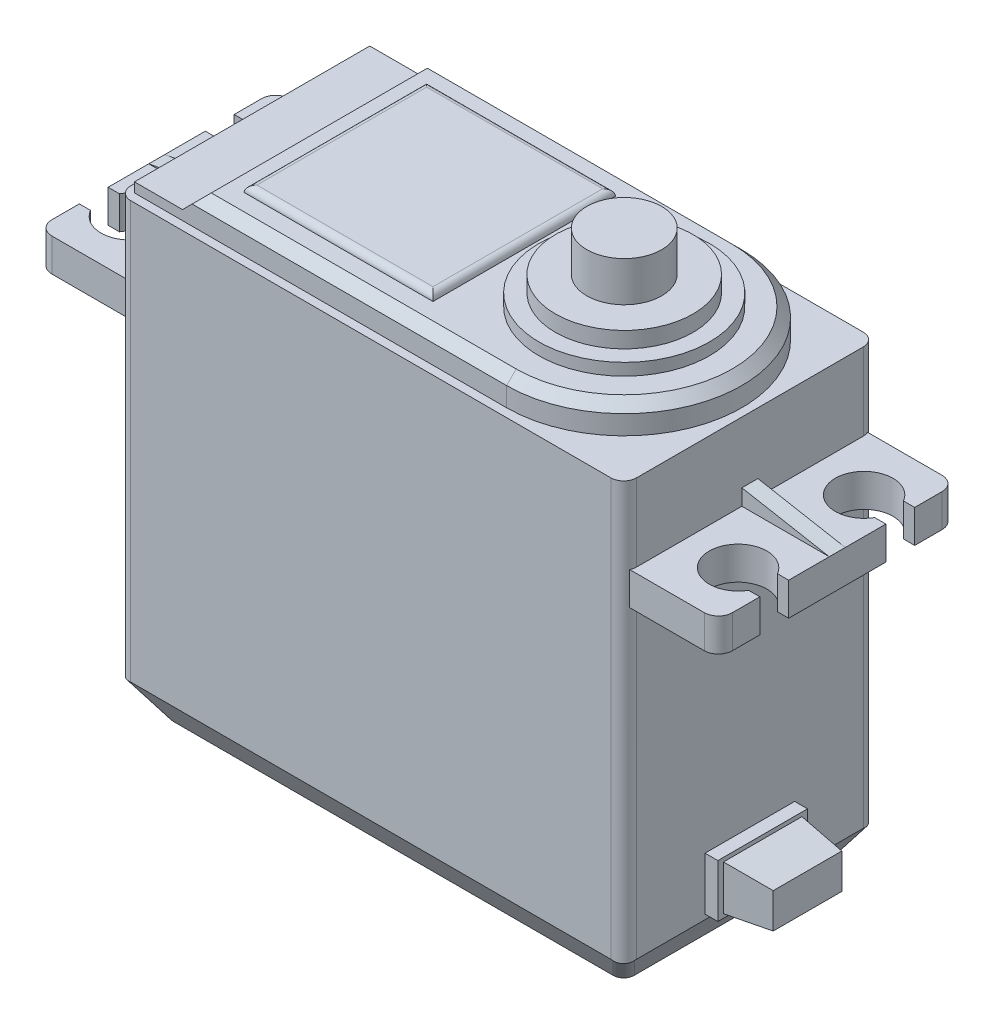
from build123d import *
from OCP.BRepFilletAPI import BRepFilletAPI_MakeChamfer

# Parameters (mm, degrees)
SKETCH1_W            = 40.132
SKETCH1_H            = 20.0279
BOSS_EXTRUDE1_DEPTH  = 35.8775
CHAMFER1_SIZE        = 1.778
CHAMFER1_SIZE2       = 2.794
SKETCH2_W            = 7.112
SKETCH2_H            = 4.191
BOSS_EXTRUDE2_DEPTH  = 1.016
SKETCH3_W            = 6.223
SKETCH3_H            = 3.556
BOSS_EXTRUDE3_DEPTH  = 3.556
CHAMFER2_SIZE        = 3.556
CHAMFER2_SIZE_2      = 0.389445338
SKETCH4_W            = 18.8722
SKETCH4_H            = 2.6162
BOSS_EXTRUDE4_DEPTH  = 6.9342
BOSS_EXTRUDE5_DEPTH  = 0.635
CUT_EXTRUDE1_REACH   = 61.169
FILLET2_R            = 1.1176
FILLET2_OF_MIRROR3_R = 1.1176
BOSS_EXTRUDE6_DEPTH  = 2.286
CHAMFER3_SIZE        = 0.762
CUT_EXTRUDE2_DEPTH   = 64.608509117
FILLET3_R            = 1.016
SKETCH12_R           = 6.7691
BOSS_EXTRUDE7_DEPTH  = 0.9525
SKETCH13_R           = 5.461
BOSS_EXTRUDE8_DEPTH  = 1.27
SKETCH15_R           = 2.9718
BOSS_EXTRUDE9_DEPTH  = 3.175
SKETCH16_W           = 14.986
SKETCH16_H           = 14.478
BOSS_EXTRUDE10_DEPTH = 0.508
FILLET4_R            = 0.508


# Some blends are built 0.0001 mm under size
with BuildPart() as part:
    # Sketch1 → Boss-Extrude1 (new body)
    with BuildSketch(Plane(origin=(0, 0, 0), x_dir=(1, 0, 0), z_dir=(0, 1, 0))):
        with Locations((20.066, 10.01395)):
            Rectangle(SKETCH1_W, SKETCH1_H)
    extrude(amount=BOSS_EXTRUDE1_DEPTH)

    # Chamfer1
    chamfer1_edges = [part.edges().sort_by_distance(p)[0] for p in [
        (20.066, 0, -20.0279),
        (40.132, 0, -10.01395),
        (20.066, 0, 0),
        (0, 0, -10.01395),
    ]]
    chamfer1_side = [part.faces().sort_by_distance(p)[0] for p in [
        (20.066, 0, -10.01395),
    ]]
    chamfer(chamfer1_edges, length=CHAMFER1_SIZE, length2=CHAMFER1_SIZE2, reference=chamfer1_side[0])

    # Sketch2 → Boss-Extrude2 (add)
    with BuildSketch(Plane(origin=(40.132, 0, 0), x_dir=(0, 0, -1), z_dir=(1, 0, 0))):
        with Locations((10.01395, 5.2705)):
            Rectangle(SKETCH2_W, SKETCH2_H)
    extrude(amount=BOSS_EXTRUDE2_DEPTH)

    # Sketch3 → Boss-Extrude3 (add)
    with BuildSketch(Plane(origin=(41.148, 0, 0), x_dir=(0, 0, -1), z_dir=(1, 0, 0))):
        with Locations((10.01395, 5.2705)):
            Rectangle(SKETCH3_W, SKETCH3_H)
    extrude(amount=BOSS_EXTRUDE3_DEPTH)

    # Chamfer2
    chamfer2_edges_1 = [part.edges().sort_by_distance(p)[0] for p in [
        (44.704, 3.4925, -10.01395),
    ]]
    chamfer2_side_1 = [part.faces().sort_by_distance(p)[0] for p in [
        (44.696211093, 3.4925, -10.01395),
    ]]
    chamfer2_edges_2 = [part.edges().sort_by_distance(p)[0] for p in [
        (44.704, 5.2705, -6.90245),
    ]]
    chamfer2_side_2 = [part.faces().sort_by_distance(p)[0] for p in [
        (44.696211093, 5.2705, -6.90245),
    ]]
    chamfer2_edges_3 = [part.edges().sort_by_distance(p)[0] for p in [
        (44.704, 7.0485, -10.01395),
    ]]
    chamfer2_side_3 = [part.faces().sort_by_distance(p)[0] for p in [
        (44.696211093, 7.0485, -10.01395),
    ]]
    chamfer2_edges_4 = [part.edges().sort_by_distance(p)[0] for p in [
        (44.704, 5.2705, -13.12545),
    ]]
    chamfer2_side_4 = [part.faces().sort_by_distance(p)[0] for p in [
        (44.696211093, 5.2705, -13.12545),
    ]]
    chamfer2 = BRepFilletAPI_MakeChamfer(part.part.solid().wrapped)
    for e in chamfer2_edges_1:
        chamfer2.Add(CHAMFER2_SIZE - 0.0001, CHAMFER2_SIZE_2 - 0.0001, e.wrapped, chamfer2_side_1[0].wrapped)
    for e in chamfer2_edges_2:
        chamfer2.Add(CHAMFER2_SIZE - 0.0001, CHAMFER2_SIZE_2 - 0.0001, e.wrapped, chamfer2_side_2[0].wrapped)
    for e in chamfer2_edges_3:
        chamfer2.Add(CHAMFER2_SIZE - 0.0001, CHAMFER2_SIZE_2 - 0.0001, e.wrapped, chamfer2_side_3[0].wrapped)
    for e in chamfer2_edges_4:
        chamfer2.Add(CHAMFER2_SIZE - 0.0001, CHAMFER2_SIZE_2 - 0.0001, e.wrapped, chamfer2_side_4[0].wrapped)
    add(Compound.cast(chamfer2.Shape()), mode=Mode.REPLACE)  # a hair under: the kernel refuses the full size

    # Sketch4 → Boss-Extrude4 (add)
    with BuildSketch(Plane(origin=(40.132, 0, 0), x_dir=(0, 0, -1), z_dir=(1, 0, 0))):
        with Locations((10.01395, 28.4353)):
            Rectangle(SKETCH4_W, SKETCH4_H)
    boss_extrude4 = extrude(amount=BOSS_EXTRUDE4_DEPTH)

    # Sketch8 → Boss-Extrude5 (add, symmetric)
    with BuildSketch(Plane.XY.offset(-10.01395)):
        Polygon((47.0662, 29.7434), (40.132, 29.7434), (40.132, 31.0134), align=None)
    boss_extrude5 = extrude(amount=BOSS_EXTRUDE5_DEPTH, both=True)

    # Sketch9 → Cut-Extrude1 (cut, up to next)
    with BuildSketch(Plane(origin=(0, 29.7434, 0), x_dir=(1, 0, 0), z_dir=(0, 1, 0)), mode=Mode.PRIVATE) as cut_extrude1_sk1:
        with BuildLine():
            Line((47.0662, 3.87095), (46.175734073, 3.87095))
            ThreePointArc((46.175734073, 3.87095), (41.91, 5.01395), (46.175734073, 6.15695))
            Line((46.175734073, 6.15695), (47.0662, 6.15695))
            Line((47.0662, 6.15695), (47.0662, 3.87095))
        make_face()
    cut_extrude1_tool1 = extrude(cut_extrude1_sk1.sketch, amount=-CUT_EXTRUDE1_REACH, mode=Mode.PRIVATE) & part.part
    # Sketch9 → Cut-Extrude1 (cut, up to next)
    with BuildSketch(Plane(origin=(0, 29.7434, 0), x_dir=(1, 0, 0), z_dir=(0, 1, 0)), mode=Mode.PRIVATE) as cut_extrude1_sk2:
        with BuildLine():
            Line((46.175734073, 13.87095), (47.0662, 13.87095))
            Line((47.0662, 13.87095), (47.0662, 16.15695))
            Line((47.0662, 16.15695), (46.175734073, 16.15695))
            ThreePointArc((46.175734073, 16.15695), (41.91, 15.01395), (46.175734073, 13.87095))
        make_face()
    cut_extrude1_tool2 = extrude(cut_extrude1_sk2.sketch, amount=-CUT_EXTRUDE1_REACH, mode=Mode.PRIVATE) & part.part
    cut_extrude1_1 = cut_extrude1_tool1.solids().sort_by_distance((44.41518, 29.7434, -5.01395))[0]
    add(cut_extrude1_1, mode=Mode.SUBTRACT)
    cut_extrude1_2 = cut_extrude1_tool2.solids().sort_by_distance((44.41518, 29.7434, -15.01395))[0]
    add(cut_extrude1_2, mode=Mode.SUBTRACT)
    cut_extrude1 = cut_extrude1_1 + cut_extrude1_2  # Cut-Extrude1 as one shape, for the pattern or mirror that repeats it

    # Fillet2
    fillet2_edges = [part.edges().sort_by_distance(p)[0] for p in [
        (47.0662, 28.4353, -19.45005),
        (47.0662, 28.4353, -0.57785),
    ]]
    fillet(fillet2_edges, radius=FILLET2_R)

    # Mirror3: Boss-Extrude4, Boss-Extrude5, Cut-Extrude1 across plane
    add(boss_extrude4.mirror(Plane(origin=(20.066, 0, 0), x_dir=(0, 0, 1), z_dir=(1, 0, 0))))
    add(boss_extrude5.mirror(Plane(origin=(20.066, 0, 0), x_dir=(0, 0, 1), z_dir=(1, 0, 0))))
    add(cut_extrude1.mirror(Plane(origin=(20.066, 0, 0), x_dir=(0, 0, 1), z_dir=(1, 0, 0))), mode=Mode.SUBTRACT)

    # Fillet2 of Mirror3
    fillet2_of_mirror3_edges = [part.edges().sort_by_distance(p)[0] for p in [
        (-6.9342, 28.4353, -19.45005),
        (-6.9342, 28.4353, -0.57785),
    ]]
    fillet(fillet2_of_mirror3_edges, radius=FILLET2_OF_MIRROR3_R)

    # Sketch10 → Boss-Extrude6 (add)
    with BuildSketch(Plane(origin=(0, 35.8775, 0), x_dir=(1, 0, 0), z_dir=(0, 1, 0))):
        with BuildLine():
            Line((30.1625, 0.67945), (0.635, 0.67945))
            Line((0.635, 0.67945), (0.635, 19.34845))
            Line((0.635, 19.34845), (30.1625, 19.34845))
            ThreePointArc((30.1625, 19.34845), (39.497, 10.01395), (30.1625, 0.67945))
        make_face()
    extrude(amount=BOSS_EXTRUDE6_DEPTH)

    # Chamfer3
    chamfer3_edges = [part.edges().sort_by_distance(p)[0] for p in [
        (39.497, 38.1635, -10.01395),
        (15.39875, 38.1635, -19.34845),
        (0.635, 38.1635, -10.01395),
        (15.39875, 38.1635, -0.67945),
    ]]
    chamfer(chamfer3_edges, length=CHAMFER3_SIZE)

    # Sketch11 → Cut-Extrude2 (cut, through all)
    with BuildSketch(Plane(origin=(0, 0, -19.34845), x_dir=(-1, 0, 0), z_dir=(0, 0, -1))):
        Polygon((-0.635, 36.6395), (-4.445, 36.6395), (-5.969, 38.1635), (-0.635, 38.1635), align=None)
    extrude(amount=-CUT_EXTRUDE2_DEPTH, mode=Mode.SUBTRACT)

    # Fillet3
    # the kernel refuses this fillet: 1.016 mm, written as the material it takes off along each edge
    with BuildSketch(Plane(origin=(0, 0.254, 0), x_dir=(1, 0, 0), z_dir=(0, 1, 0))) as fillet3_piece_1_section:
        with BuildLine():
            CenterArc((FILLET3_R, FILLET3_R), FILLET3_R, 180, 90)
            Line((0, FILLET3_R), (0, 0))
            Line((0, 0), (FILLET3_R, 0))
        make_face()
    fillet3_piece_1 = extrude(amount=38.1635, mode=Mode.PRIVATE)
    fillet3_piece_1 = split(fillet3_piece_1, bisect_by=Plane(origin=(0.25078898, 27.1272, -0.181992071), z_dir=(0, -1, 0)), keep=Keep.TOP, mode=Mode.PRIVATE)
    fillet3_piece_1 = split(fillet3_piece_1, bisect_by=Plane(origin=(0.25078898, 13.6906, -0.57785), z_dir=(0, 0, 1)), keep=Keep.TOP, mode=Mode.PRIVATE)
    add(fillet3_piece_1, mode=Mode.SUBTRACT)
    with BuildSketch(Plane(origin=(0, 0.254, 0), x_dir=(1, 0, 0), z_dir=(0, 1, 0))) as fillet3_piece_2_section:
        with BuildLine():
            CenterArc((FILLET3_R, FILLET3_R), FILLET3_R, 180, 90)
            Line((0, FILLET3_R), (0, 0))
            Line((0, 0), (FILLET3_R, 0))
        make_face()
    fillet3_piece_2 = extrude(amount=38.1635, mode=Mode.PRIVATE)
    fillet3_piece_2 = split(fillet3_piece_2, bisect_by=Plane(origin=(0.014243529, 27.1272, -0.728902871), z_dir=(0, -1, 0)), keep=Keep.TOP, mode=Mode.PRIVATE)
    fillet3_piece_2 = split(fillet3_piece_2, bisect_by=Plane(origin=(0.014243529, 13.6906, -0.57785), z_dir=(0, 0, -1)), keep=Keep.TOP, mode=Mode.PRIVATE)
    add(fillet3_piece_2, mode=Mode.SUBTRACT)
    with BuildSketch(Plane(origin=(0, 0.254, 0), x_dir=(1, 0, 0), z_dir=(0, 1, 0))) as fillet3_piece_3_section:
        with BuildLine():
            CenterArc((FILLET3_R, FILLET3_R), FILLET3_R, 180, 90)
            Line((0, FILLET3_R), (0, 0))
            Line((0, 0), (FILLET3_R, 0))
        make_face()
    fillet3_piece_3 = extrude(amount=38.1635, mode=Mode.PRIVATE)
    fillet3_piece_3 = split(fillet3_piece_3, bisect_by=Plane(origin=(0.25078898, 27.1272, -0.181992071), z_dir=(0, 1, 0)), keep=Keep.TOP, mode=Mode.PRIVATE)
    fillet3_piece_3 = split(fillet3_piece_3, bisect_by=Plane(origin=(0.25078898, 29.7434, -0.181992071), z_dir=(0, -1, 0)), keep=Keep.TOP, mode=Mode.PRIVATE)
    fillet3_piece_3 = split(fillet3_piece_3, bisect_by=Plane(origin=(0.25078898, 28.4353, -0.57785), z_dir=(0, 0, 1)), keep=Keep.TOP, mode=Mode.PRIVATE)
    add(fillet3_piece_3, mode=Mode.SUBTRACT)
    with BuildSketch(Plane(origin=(0, 0.254, 0), x_dir=(1, 0, 0), z_dir=(0, 1, 0))) as fillet3_piece_4_section:
        with BuildLine():
            CenterArc((FILLET3_R, FILLET3_R), FILLET3_R, 180, 90)
            Line((0, FILLET3_R), (0, 0))
            Line((0, 0), (FILLET3_R, 0))
        make_face()
    fillet3_piece_4 = extrude(amount=38.1635, mode=Mode.PRIVATE)
    fillet3_piece_4 = split(fillet3_piece_4, bisect_by=Plane(origin=(0.25078898, 29.7434, -0.181992071), z_dir=(0, 1, 0)), keep=Keep.TOP, mode=Mode.PRIVATE)
    fillet3_piece_4 = split(fillet3_piece_4, bisect_by=Plane(origin=(0.25078898, 34.08045, -0.57785), z_dir=(0, 0, 1)), keep=Keep.TOP, mode=Mode.PRIVATE)
    add(fillet3_piece_4, mode=Mode.SUBTRACT)
    with BuildSketch(Plane(origin=(0, 0.254, 0), x_dir=(1, 0, 0), z_dir=(0, 1, 0))) as fillet3_piece_5_section:
        with BuildLine():
            CenterArc((FILLET3_R, FILLET3_R), FILLET3_R, 180, 90)
            Line((0, FILLET3_R), (0, 0))
            Line((0, 0), (FILLET3_R, 0))
        make_face()
    fillet3_piece_5 = extrude(amount=38.1635, mode=Mode.PRIVATE)
    fillet3_piece_5 = split(fillet3_piece_5, bisect_by=Plane(origin=(0.014243529, 29.7434, -0.728902871), z_dir=(0, 1, 0)), keep=Keep.TOP, mode=Mode.PRIVATE)
    fillet3_piece_5 = split(fillet3_piece_5, bisect_by=Plane(origin=(0.014243529, 34.08045, -0.57785), z_dir=(0, 0, -1)), keep=Keep.TOP, mode=Mode.PRIVATE)
    add(fillet3_piece_5, mode=Mode.SUBTRACT)
    with BuildSketch(Plane(origin=(2.671059361, -1.403378995, -2.671059361), x_dir=(0.8810537485094524, 0.39906552138369294, 0.25395078633507695), z_dir=(-0.4730161648796398, 0.7433111162394347, 0.4730161648796402)), Plane(origin=(2.671059361, -1.403378995, -17.356840639), x_dir=(-0.25395078633507684, 0.39906552138369294, 0.8810537485094524), z_dir=(-0.47301616487964054, 0.7433111162394347, -0.4730161648796398))) as fillet3_piece_6:
        with BuildLine():
            CenterArc((FILLET3_R * 0.743311116239, FILLET3_R), FILLET3_R, 196.752335114, 73.247664886)
            Line((-FILLET3_R * 0.21424849821, FILLET3_R * 0.711764705882), (0, 0))
            Line((0, 0), (FILLET3_R * 0.743311116239, 0))
        make_face()
    extrude(amount=7.534877212, mode=Mode.SUBTRACT)
    with BuildSketch(Plane(origin=(0, 0.254, -20.0279), x_dir=(0, 0, 1), z_dir=(0, 1, 0))) as fillet3_piece_7_section:
        with BuildLine():
            CenterArc((FILLET3_R, FILLET3_R), FILLET3_R, 180, 90)
            Line((0, FILLET3_R), (0, 0))
            Line((0, 0), (FILLET3_R, 0))
        make_face()
    fillet3_piece_7 = extrude(amount=38.1635, mode=Mode.PRIVATE)
    fillet3_piece_7 = split(fillet3_piece_7, bisect_by=Plane(origin=(0.014243529, 27.1272, -19.298997129), z_dir=(0, -1, 0)), keep=Keep.TOP, mode=Mode.PRIVATE)
    fillet3_piece_7 = split(fillet3_piece_7, bisect_by=Plane(origin=(0.014243529, 13.6906, -19.45005), z_dir=(0, 0, 1)), keep=Keep.TOP, mode=Mode.PRIVATE)
    add(fillet3_piece_7, mode=Mode.SUBTRACT)
    with BuildSketch(Plane(origin=(0, 0.254, -20.0279), x_dir=(0, 0, 1), z_dir=(0, 1, 0))) as fillet3_piece_8_section:
        with BuildLine():
            CenterArc((FILLET3_R, FILLET3_R), FILLET3_R, 180, 90)
            Line((0, FILLET3_R), (0, 0))
            Line((0, 0), (FILLET3_R, 0))
        make_face()
    fillet3_piece_8 = extrude(amount=38.1635, mode=Mode.PRIVATE)
    fillet3_piece_8 = split(fillet3_piece_8, bisect_by=Plane(origin=(0.25078898, 27.1272, -19.845907929), z_dir=(0, -1, 0)), keep=Keep.TOP, mode=Mode.PRIVATE)
    fillet3_piece_8 = split(fillet3_piece_8, bisect_by=Plane(origin=(0.25078898, 13.6906, -19.45005), z_dir=(0, 0, -1)), keep=Keep.TOP, mode=Mode.PRIVATE)
    add(fillet3_piece_8, mode=Mode.SUBTRACT)
    with BuildSketch(Plane(origin=(0, 0.254, -20.0279), x_dir=(0, 0, 1), z_dir=(0, 1, 0))) as fillet3_piece_9_section:
        with BuildLine():
            CenterArc((FILLET3_R, FILLET3_R), FILLET3_R, 180, 90)
            Line((0, FILLET3_R), (0, 0))
            Line((0, 0), (FILLET3_R, 0))
        make_face()
    fillet3_piece_9 = extrude(amount=38.1635, mode=Mode.PRIVATE)
    fillet3_piece_9 = split(fillet3_piece_9, bisect_by=Plane(origin=(0.25078898, 27.1272, -19.845907929), z_dir=(0, 1, 0)), keep=Keep.TOP, mode=Mode.PRIVATE)
    fillet3_piece_9 = split(fillet3_piece_9, bisect_by=Plane(origin=(0.25078898, 28.4353, -19.45005), z_dir=(0, 0, -1)), keep=Keep.TOP, mode=Mode.PRIVATE)
    fillet3_piece_9 = split(fillet3_piece_9, bisect_by=Plane(origin=(0.25078898, 29.7434, -19.845907929), z_dir=(0, -1, 0)), keep=Keep.TOP, mode=Mode.PRIVATE)
    add(fillet3_piece_9, mode=Mode.SUBTRACT)
    with BuildSketch(Plane(origin=(0, 0.254, -20.0279), x_dir=(0, 0, 1), z_dir=(0, 1, 0))) as fillet3_piece_10_section:
        with BuildLine():
            CenterArc((FILLET3_R, FILLET3_R), FILLET3_R, 180, 90)
            Line((0, FILLET3_R), (0, 0))
            Line((0, 0), (FILLET3_R, 0))
        make_face()
    fillet3_piece_10 = extrude(amount=38.1635, mode=Mode.PRIVATE)
    fillet3_piece_10 = split(fillet3_piece_10, bisect_by=Plane(origin=(0.014243529, 34.08045, -19.45005), z_dir=(0, 0, 1)), keep=Keep.TOP, mode=Mode.PRIVATE)
    fillet3_piece_10 = split(fillet3_piece_10, bisect_by=Plane(origin=(0.014243529, 29.7434, -19.298997129), z_dir=(0, 1, 0)), keep=Keep.TOP, mode=Mode.PRIVATE)
    add(fillet3_piece_10, mode=Mode.SUBTRACT)
    with BuildSketch(Plane(origin=(0, 0.254, -20.0279), x_dir=(0, 0, 1), z_dir=(0, 1, 0))) as fillet3_piece_11_section:
        with BuildLine():
            CenterArc((FILLET3_R, FILLET3_R), FILLET3_R, 180, 90)
            Line((0, FILLET3_R), (0, 0))
            Line((0, 0), (FILLET3_R, 0))
        make_face()
    fillet3_piece_11 = extrude(amount=38.1635, mode=Mode.PRIVATE)
    fillet3_piece_11 = split(fillet3_piece_11, bisect_by=Plane(origin=(0.25078898, 34.08045, -19.45005), z_dir=(0, 0, -1)), keep=Keep.TOP, mode=Mode.PRIVATE)
    fillet3_piece_11 = split(fillet3_piece_11, bisect_by=Plane(origin=(0.25078898, 29.7434, -19.845907929), z_dir=(0, 1, 0)), keep=Keep.TOP, mode=Mode.PRIVATE)
    add(fillet3_piece_11, mode=Mode.SUBTRACT)
    with BuildSketch(Plane(origin=(37.460940639, -1.403378995, -17.356840639), x_dir=(0.2539507863350758, 0.3990655213836938, 0.8810537485094523), z_dir=(0.47301616487963993, 0.7433111162394348, -0.47301616487963993)), Plane(origin=(37.460940639, -1.403378995, -2.671059361), x_dir=(-0.8810537485094524, 0.3990655213836928, 0.2539507863350774), z_dir=(0.4730161648796399, 0.7433111162394347, 0.47301616487964027))) as fillet3_piece_12:
        with BuildLine():
            CenterArc((FILLET3_R * 0.743311116239, -FILLET3_R), FILLET3_R, 90, 73.247664886)
            Line((-FILLET3_R * 0.21424849821, -FILLET3_R * 0.711764705882), (0, 0))
            Line((0, 0), (FILLET3_R * 0.743311116239, 0))
        make_face()
    extrude(amount=7.534877212, mode=Mode.SUBTRACT)
    with BuildSketch(Plane(origin=(40.132, 0.254, 0), x_dir=(-1, 0, 0), z_dir=(0, 1, 0))) as fillet3_piece_13_section:
        with BuildLine():
            CenterArc((FILLET3_R, -FILLET3_R), FILLET3_R, 90, 90)
            Line((0, -FILLET3_R), (0, 0))
            Line((0, 0), (FILLET3_R, 0))
        make_face()
    fillet3_piece_13 = extrude(amount=38.1635, mode=Mode.PRIVATE)
    fillet3_piece_13 = split(fillet3_piece_13, bisect_by=Plane(origin=(39.88121102, 27.1272, -0.181992071), z_dir=(0, -1, 0)), keep=Keep.TOP, mode=Mode.PRIVATE)
    fillet3_piece_13 = split(fillet3_piece_13, bisect_by=Plane(origin=(39.88121102, 13.6906, -0.57785), z_dir=(0, 0, 1)), keep=Keep.TOP, mode=Mode.PRIVATE)
    add(fillet3_piece_13, mode=Mode.SUBTRACT)
    with BuildSketch(Plane(origin=(40.132, 0.254, 0), x_dir=(-1, 0, 0), z_dir=(0, 1, 0))) as fillet3_piece_14_section:
        with BuildLine():
            CenterArc((FILLET3_R, -FILLET3_R), FILLET3_R, 90, 90)
            Line((0, -FILLET3_R), (0, 0))
            Line((0, 0), (FILLET3_R, 0))
        make_face()
    fillet3_piece_14 = extrude(amount=38.1635, mode=Mode.PRIVATE)
    fillet3_piece_14 = split(fillet3_piece_14, bisect_by=Plane(origin=(40.117756471, 27.1272, -0.728902871), z_dir=(0, -1, 0)), keep=Keep.TOP, mode=Mode.PRIVATE)
    fillet3_piece_14 = split(fillet3_piece_14, bisect_by=Plane(origin=(40.117756471, 13.6906, -0.57785), z_dir=(0, 0, -1)), keep=Keep.TOP, mode=Mode.PRIVATE)
    add(fillet3_piece_14, mode=Mode.SUBTRACT)
    with BuildSketch(Plane(origin=(40.132, 0.254, 0), x_dir=(-1, 0, 0), z_dir=(0, 1, 0))) as fillet3_piece_15_section:
        with BuildLine():
            CenterArc((FILLET3_R, -FILLET3_R), FILLET3_R, 90, 90)
            Line((0, -FILLET3_R), (0, 0))
            Line((0, 0), (FILLET3_R, 0))
        make_face()
    fillet3_piece_15 = extrude(amount=38.1635, mode=Mode.PRIVATE)
    fillet3_piece_15 = split(fillet3_piece_15, bisect_by=Plane(origin=(39.88121102, 29.7434, -0.181992071), z_dir=(0, -1, 0)), keep=Keep.TOP, mode=Mode.PRIVATE)
    fillet3_piece_15 = split(fillet3_piece_15, bisect_by=Plane(origin=(39.88121102, 27.1272, -0.181992071), z_dir=(0, 1, 0)), keep=Keep.TOP, mode=Mode.PRIVATE)
    fillet3_piece_15 = split(fillet3_piece_15, bisect_by=Plane(origin=(39.88121102, 28.4353, -0.57785), z_dir=(0, 0, 1)), keep=Keep.TOP, mode=Mode.PRIVATE)
    add(fillet3_piece_15, mode=Mode.SUBTRACT)
    with BuildSketch(Plane(origin=(40.132, 0.254, 0), x_dir=(-1, 0, 0), z_dir=(0, 1, 0))) as fillet3_piece_16_section:
        with BuildLine():
            CenterArc((FILLET3_R, -FILLET3_R), FILLET3_R, 90, 90)
            Line((0, -FILLET3_R), (0, 0))
            Line((0, 0), (FILLET3_R, 0))
        make_face()
    fillet3_piece_16 = extrude(amount=38.1635, mode=Mode.PRIVATE)
    fillet3_piece_16 = split(fillet3_piece_16, bisect_by=Plane(origin=(39.88121102, 29.7434, -0.181992071), z_dir=(0, 1, 0)), keep=Keep.TOP, mode=Mode.PRIVATE)
    fillet3_piece_16 = split(fillet3_piece_16, bisect_by=Plane(origin=(39.88121102, 34.08045, -0.57785), z_dir=(0, 0, 1)), keep=Keep.TOP, mode=Mode.PRIVATE)
    add(fillet3_piece_16, mode=Mode.SUBTRACT)
    with BuildSketch(Plane(origin=(40.132, 0.254, 0), x_dir=(-1, 0, 0), z_dir=(0, 1, 0))) as fillet3_piece_17_section:
        with BuildLine():
            CenterArc((FILLET3_R, -FILLET3_R), FILLET3_R, 90, 90)
            Line((0, -FILLET3_R), (0, 0))
            Line((0, 0), (FILLET3_R, 0))
        make_face()
    fillet3_piece_17 = extrude(amount=38.1635, mode=Mode.PRIVATE)
    fillet3_piece_17 = split(fillet3_piece_17, bisect_by=Plane(origin=(40.117756471, 29.7434, -0.728902871), z_dir=(0, 1, 0)), keep=Keep.TOP, mode=Mode.PRIVATE)
    fillet3_piece_17 = split(fillet3_piece_17, bisect_by=Plane(origin=(40.117756471, 34.08045, -0.57785), z_dir=(0, 0, -1)), keep=Keep.TOP, mode=Mode.PRIVATE)
    add(fillet3_piece_17, mode=Mode.SUBTRACT)
    with BuildSketch(Plane(origin=(40.132, 0.254, -20.0279), x_dir=(0, 0, 1), z_dir=(0, 1, 0))) as fillet3_piece_18_section:
        with BuildLine():
            CenterArc((FILLET3_R, -FILLET3_R), FILLET3_R, 90, 90)
            Line((0, -FILLET3_R), (0, 0))
            Line((0, 0), (FILLET3_R, 0))
        make_face()
    fillet3_piece_18 = extrude(amount=38.1635, mode=Mode.PRIVATE)
    fillet3_piece_18 = split(fillet3_piece_18, bisect_by=Plane(origin=(40.117756471, 13.6906, -19.45005), z_dir=(0, 0, 1)), keep=Keep.TOP, mode=Mode.PRIVATE)
    fillet3_piece_18 = split(fillet3_piece_18, bisect_by=Plane(origin=(40.117756471, 27.1272, -19.298997129), z_dir=(0, -1, 0)), keep=Keep.TOP, mode=Mode.PRIVATE)
    add(fillet3_piece_18, mode=Mode.SUBTRACT)
    with BuildSketch(Plane(origin=(40.132, 0.254, -20.0279), x_dir=(0, 0, 1), z_dir=(0, 1, 0))) as fillet3_piece_19_section:
        with BuildLine():
            CenterArc((FILLET3_R, -FILLET3_R), FILLET3_R, 90, 90)
            Line((0, -FILLET3_R), (0, 0))
            Line((0, 0), (FILLET3_R, 0))
        make_face()
    fillet3_piece_19 = extrude(amount=38.1635, mode=Mode.PRIVATE)
    fillet3_piece_19 = split(fillet3_piece_19, bisect_by=Plane(origin=(39.88121102, 13.6906, -19.45005), z_dir=(0, 0, -1)), keep=Keep.TOP, mode=Mode.PRIVATE)
    fillet3_piece_19 = split(fillet3_piece_19, bisect_by=Plane(origin=(39.88121102, 27.1272, -19.845907929), z_dir=(0, -1, 0)), keep=Keep.TOP, mode=Mode.PRIVATE)
    add(fillet3_piece_19, mode=Mode.SUBTRACT)
    with BuildSketch(Plane(origin=(40.132, 0.254, -20.0279), x_dir=(0, 0, 1), z_dir=(0, 1, 0))) as fillet3_piece_20_section:
        with BuildLine():
            CenterArc((FILLET3_R, -FILLET3_R), FILLET3_R, 90, 90)
            Line((0, -FILLET3_R), (0, 0))
            Line((0, 0), (FILLET3_R, 0))
        make_face()
    fillet3_piece_20 = extrude(amount=38.1635, mode=Mode.PRIVATE)
    fillet3_piece_20 = split(fillet3_piece_20, bisect_by=Plane(origin=(39.88121102, 29.7434, -19.845907929), z_dir=(0, -1, 0)), keep=Keep.TOP, mode=Mode.PRIVATE)
    fillet3_piece_20 = split(fillet3_piece_20, bisect_by=Plane(origin=(39.88121102, 28.4353, -19.45005), z_dir=(0, 0, -1)), keep=Keep.TOP, mode=Mode.PRIVATE)
    fillet3_piece_20 = split(fillet3_piece_20, bisect_by=Plane(origin=(39.88121102, 27.1272, -19.845907929), z_dir=(0, 1, 0)), keep=Keep.TOP, mode=Mode.PRIVATE)
    add(fillet3_piece_20, mode=Mode.SUBTRACT)
    with BuildSketch(Plane(origin=(40.132, 0.254, -20.0279), x_dir=(0, 0, 1), z_dir=(0, 1, 0))) as fillet3_piece_21_section:
        with BuildLine():
            CenterArc((FILLET3_R, -FILLET3_R), FILLET3_R, 90, 90)
            Line((0, -FILLET3_R), (0, 0))
            Line((0, 0), (FILLET3_R, 0))
        make_face()
    fillet3_piece_21 = extrude(amount=38.1635, mode=Mode.PRIVATE)
    fillet3_piece_21 = split(fillet3_piece_21, bisect_by=Plane(origin=(40.117756471, 29.7434, -19.298997129), z_dir=(0, 1, 0)), keep=Keep.TOP, mode=Mode.PRIVATE)
    fillet3_piece_21 = split(fillet3_piece_21, bisect_by=Plane(origin=(40.117756471, 34.08045, -19.45005), z_dir=(0, 0, 1)), keep=Keep.TOP, mode=Mode.PRIVATE)
    add(fillet3_piece_21, mode=Mode.SUBTRACT)
    with BuildSketch(Plane(origin=(40.132, 0.254, -20.0279), x_dir=(0, 0, 1), z_dir=(0, 1, 0))) as fillet3_piece_22_section:
        with BuildLine():
            CenterArc((FILLET3_R, -FILLET3_R), FILLET3_R, 90, 90)
            Line((0, -FILLET3_R), (0, 0))
            Line((0, 0), (FILLET3_R, 0))
        make_face()
    fillet3_piece_22 = extrude(amount=38.1635, mode=Mode.PRIVATE)
    fillet3_piece_22 = split(fillet3_piece_22, bisect_by=Plane(origin=(39.88121102, 29.7434, -19.845907929), z_dir=(0, 1, 0)), keep=Keep.TOP, mode=Mode.PRIVATE)
    fillet3_piece_22 = split(fillet3_piece_22, bisect_by=Plane(origin=(39.88121102, 34.08045, -19.45005), z_dir=(0, 0, -1)), keep=Keep.TOP, mode=Mode.PRIVATE)
    add(fillet3_piece_22, mode=Mode.SUBTRACT)

    # Sketch12 → Boss-Extrude7 (add)
    with BuildSketch(Plane(origin=(0, 38.1635, 0), x_dir=(1, 0, 0), z_dir=(0, 1, 0))):
        with Locations(Location((30.1625, 10.01395, 0), (0, 0, 90))):
            Circle(SKETCH12_R)
    extrude(amount=BOSS_EXTRUDE7_DEPTH)

    # Sketch13 → Boss-Extrude8 (add)
    with BuildSketch(Plane(origin=(0, 39.116, 0), x_dir=(1, 0, 0), z_dir=(0, 1, 0))):
        with Locations(Location((30.1625, 10.01395, 0), (0, 0, 270))):
            Circle(SKETCH13_R)
    extrude(amount=BOSS_EXTRUDE8_DEPTH)

    # Sketch15 → Boss-Extrude9 (add)
    with BuildSketch(Plane(origin=(0, 40.386, 0), x_dir=(1, 0, 0), z_dir=(0, 1, 0))):
        with Locations(Location((30.1625, 10.01395, 0), (0, 0, 270))):
            Circle(SKETCH15_R)
    extrude(amount=BOSS_EXTRUDE9_DEPTH)

    # Sketch16 → Boss-Extrude10 (add)
    with BuildSketch(Plane(origin=(0, 38.1635, 0), x_dir=(1, 0, 0), z_dir=(0, 1, 0))):
        with Locations((14.732, 10.01395)):
            Rectangle(SKETCH16_W, SKETCH16_H)
    extrude(amount=BOSS_EXTRUDE10_DEPTH)

    # Fillet4
    fillet4_edges = [part.edges().sort_by_distance(p)[0] for p in [
        (14.732, 38.6715, -17.25295),
        (22.225, 38.6715, -10.01395),
        (14.732, 38.6715, -2.77495),
        (7.239, 38.6715, -10.01395),
    ]]
    fillet(fillet4_edges, radius=FILLET4_R - 0.0001)  # a hair under: the kernel refuses the full size


solid = part.part
